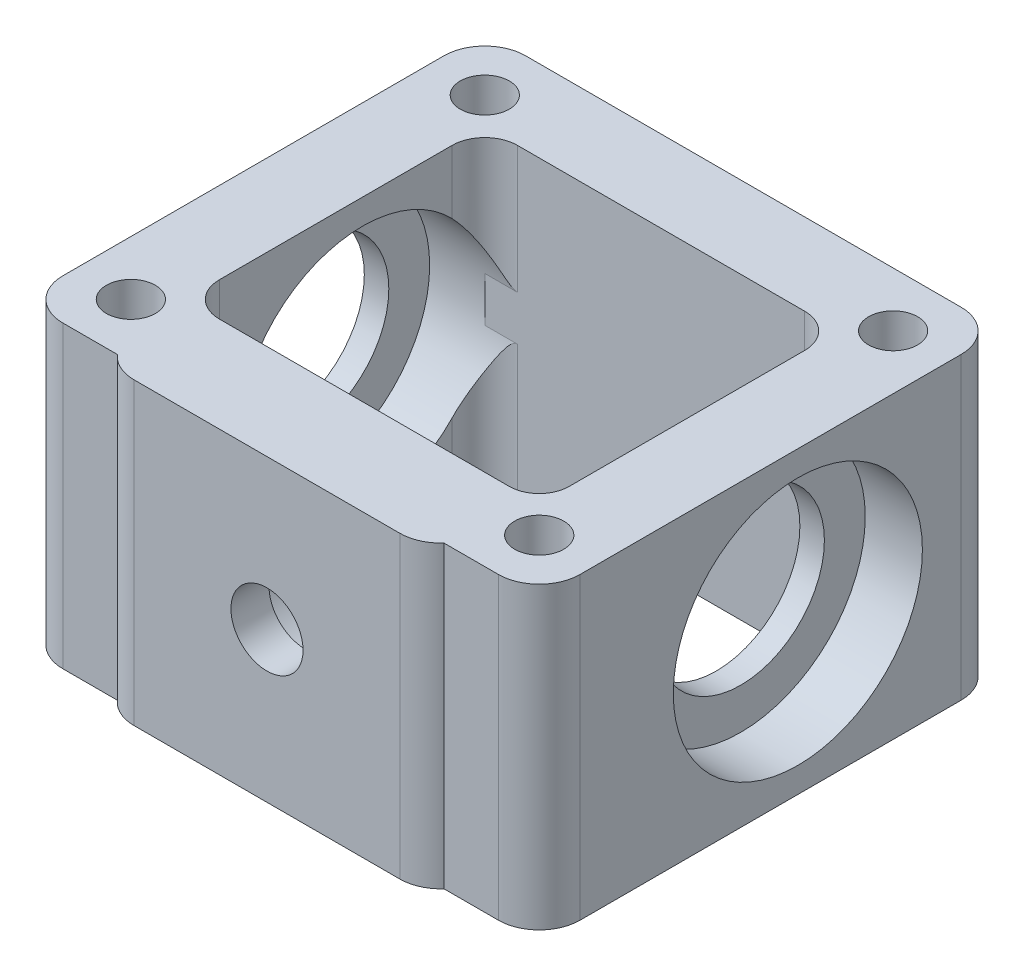
from build123d import *

# Parameters (mm, degrees)
SKETCH3_W           = 38
SKETCH3_H           = 34
SKETCH3_W_2         = 26
SKETCH3_H_2         = 22
BOSS_EXTRUDE1_DEPTH = 22
SKETCH4_W           = 24
SKETCH4_H           = 22
BOSS_EXTRUDE2_DEPTH = 1
SKETCH5_R           = 2.65
CUT_EXTRUDE1_DEPTH  = 12
SKETCH7_R           = 5.65
CUT_EXTRUDE3_DEPTH  = 4.2
SKETCH8_R           = 6.15
CUT_EXTRUDE4_DEPTH  = 57.151580565
SKETCH9_R           = 9.15
CUT_EXTRUDE5_DEPTH  = 4.2
SKETCH10_R          = 9.15
CUT_EXTRUDE6_DEPTH  = 4.2
SKETCH15_R          = 1.8
CUT_EXTRUDE7_DEPTH  = 57.151580565
FILLET1_R           = 3
FILLET3_R           = 2.5
FILLET4_R           = 2.2
FILLET5_R           = 2.4


with BuildPart() as part:
    # Sketch3 → Boss-Extrude1 (new body)
    with BuildSketch(Plane(origin=(0, 0, 0), x_dir=(1, 0, 0), z_dir=(0, 1, 0))):
        with Locations((19, -17)):
            Rectangle(SKETCH3_W, SKETCH3_H)
        with Locations((19, -17)):
            Rectangle(SKETCH3_W_2, SKETCH3_H_2, mode=Mode.SUBTRACT)
    extrude(amount=BOSS_EXTRUDE1_DEPTH)

    # Sketch4 → Boss-Extrude2 (add)
    with BuildSketch(Plane.XY.offset(34)):
        with Locations((19, 11)):
            Rectangle(SKETCH4_W, SKETCH4_H)
    extrude(amount=BOSS_EXTRUDE2_DEPTH)

    # Sketch5 → Cut-Extrude1 (cut)
    with BuildSketch(Plane.XY.offset(35)):
        with Locations((19, 11)):
            Circle(SKETCH5_R)
    extrude(amount=-CUT_EXTRUDE1_DEPTH, mode=Mode.SUBTRACT)

    # Sketch7 → Cut-Extrude3 (cut)
    with BuildSketch(Plane(origin=(0, 0, 28), x_dir=(-1, 0, 0), z_dir=(0, 0, -1))):
        with Locations((-19, 11)):
            Circle(SKETCH7_R)
    extrude(amount=-CUT_EXTRUDE3_DEPTH, mode=Mode.SUBTRACT)

    # Sketch8 → Cut-Extrude4 (cut, through all)
    with BuildSketch(Plane(origin=(38, 0, 0), x_dir=(0, 0, -1), z_dir=(1, 0, 0))):
        with Locations((-15, 11)):
            Circle(SKETCH8_R)
    extrude(amount=-CUT_EXTRUDE4_DEPTH, mode=Mode.SUBTRACT)

    # Sketch9 → Cut-Extrude5 (cut)
    with BuildSketch(Plane(origin=(6, 0, 0), x_dir=(0, 0, -1), z_dir=(1, 0, 0))):
        with Locations((-15, 11)):
            Circle(SKETCH9_R)
    extrude(amount=-CUT_EXTRUDE5_DEPTH, mode=Mode.SUBTRACT)

    # Sketch10 → Cut-Extrude6 (cut)
    with BuildSketch(Plane(origin=(38, 0, 0), x_dir=(0, 0, -1), z_dir=(1, 0, 0))):
        with Locations((-15, 11)):
            Circle(SKETCH10_R)
    extrude(amount=-CUT_EXTRUDE6_DEPTH, mode=Mode.SUBTRACT)

    # Sketch15 → Cut-Extrude7 (cut, through all)
    with BuildSketch(Plane(origin=(0, 0, 0), x_dir=(-1, 0, 0), z_dir=(0, -1, 0))):
        with Locations(Location((-4, -30, 0), (0, 0, 90))):
            Circle(SKETCH15_R)
        with Locations(Location((-34, -30, 0), (0, 0, 90))):
            Circle(SKETCH15_R)
        with Locations(Location((-34, -4, 0), (0, 0, 90))):
            Circle(SKETCH15_R)
        with Locations(Location((-4, -4, 0), (0, 0, 90))):
            Circle(SKETCH15_R)
    extrude(amount=-CUT_EXTRUDE7_DEPTH, mode=Mode.SUBTRACT)

    # Fillet1
    # the kernel refuses this fillet: 3 mm, written as the material it takes off along each edge
    with BuildSketch(Plane(origin=(38, -7.5, 0), x_dir=(-1, 0, 0), z_dir=(0, 1, 0)), Plane(origin=(38, -7.5, 34), x_dir=(0, 0, -1), z_dir=(0, 1, 0))) as fillet1_piece_1:
        with BuildLine():
            CenterArc((FILLET1_R, FILLET1_R), FILLET1_R, 180, 90)
            Line((0, FILLET1_R), (-FILLET1_R * 0.02, FILLET1_R))
            Line((-FILLET1_R * 0.02, FILLET1_R), (-FILLET1_R * 0.02, -FILLET1_R * 0.02))
            Line((-FILLET1_R * 0.02, -FILLET1_R * 0.02), (FILLET1_R, -FILLET1_R * 0.02))
            Line((FILLET1_R, -FILLET1_R * 0.02), (FILLET1_R, 0))
        make_face()
    extrude(amount=37, mode=Mode.SUBTRACT)
    with BuildSketch(Plane(origin=(7, -5.590169944, 35), x_dir=(0, 0, -1), z_dir=(0, 1, 0)), Plane(origin=(31, 27.590169944, 35), x_dir=(0, 0, -1), z_dir=(0, -1, 0))) as fillet1_piece_2:
        with BuildLine():
            CenterArc((3, -2.236067977), FILLET1_R, 131.810314896, 48.189685104)
            Line((0, -2.236067977), (-0.06, -2.236067977))
            Line((-0.06, -2.236067977), (-0.06, 0))
            Line((-0.06, 0), (0, 0.06))
            ThreePointArc((0, 0.06), (0.5, 0.06), (0.96, 0.04472136))
            Line((0.96, 0.04472136), (1, 0))
        make_face()
    extrude(amount=33.180339887, mode=Mode.SUBTRACT)
    with BuildSketch(Plane(origin=(0, -7.5, 34), x_dir=(0, 0, -1), z_dir=(0, 1, 0)), Plane(origin=(0, -7.5, 0), x_dir=(1, 0, 0), z_dir=(0, 1, 0))) as fillet1_piece_3:
        with BuildLine():
            CenterArc((FILLET1_R, -FILLET1_R), FILLET1_R, 90, 90)
            Line((0, -FILLET1_R), (-FILLET1_R * 0.02, -FILLET1_R))
            Line((-FILLET1_R * 0.02, -FILLET1_R), (-FILLET1_R * 0.02, FILLET1_R * 0.02))
            Line((-FILLET1_R * 0.02, FILLET1_R * 0.02), (FILLET1_R, FILLET1_R * 0.02))
            Line((FILLET1_R, FILLET1_R * 0.02), (FILLET1_R, 0))
        make_face()
    extrude(amount=37, mode=Mode.SUBTRACT)

    # Fillet3
    fillet3_edges = [part.edges().sort_by_distance(p)[0] for p in [
        (6, 11, 28),
        (32, 11, 6),
    ]]
    fillet(fillet3_edges, radius=FILLET3_R)

    # Fillet4
    fillet4_edges = [part.edges().sort_by_distance(p)[0] for p in [
        (32, 11, 28),
    ]]
    fillet(fillet4_edges, radius=FILLET4_R)

    # Fillet5
    # the kernel refuses this fillet: 2.4 mm, written as the material it adds along each edge
    with BuildSketch(Plane(origin=(6, 6.65, 6), x_dir=(0, 0, 1), z_dir=(0, 1, 0))) as fillet5_piece_1_section:
        with BuildLine():
            CenterArc((FILLET5_R, FILLET5_R), FILLET5_R, 180, 90)
            Line((0, FILLET5_R), (0, 0))
            Line((0, 0), (FILLET5_R, 0))
        make_face()
    fillet5_piece_1 = extrude(amount=15.35, mode=Mode.PRIVATE)
    fillet5_piece_1 = fillet5_piece_1 - Plane(origin=(6.746267067, 11, 15), x_dir=(0, 0, -1), z_dir=(1, 0, 0)) * Cylinder(9.15, 41, mode=Mode.PRIVATE)
    add(fillet5_piece_1)
    with BuildSketch(Plane(origin=(6, 0, 6), x_dir=(0, 0, 1), z_dir=(0, 1, 0))) as fillet5_piece_2_section:
        with BuildLine():
            CenterArc((FILLET5_R, FILLET5_R), FILLET5_R, 180, 90)
            Line((0, FILLET5_R), (0, 0))
            Line((0, 0), (FILLET5_R, 0))
        make_face()
    fillet5_piece_2 = extrude(amount=15.35, mode=Mode.PRIVATE)
    fillet5_piece_2 = fillet5_piece_2 - Plane(origin=(6.573929996, 11, 15), x_dir=(0, 0, -1), z_dir=(1, 0, 0)) * Cylinder(9.15, 41, mode=Mode.PRIVATE)
    add(fillet5_piece_2)


solid = part.part
